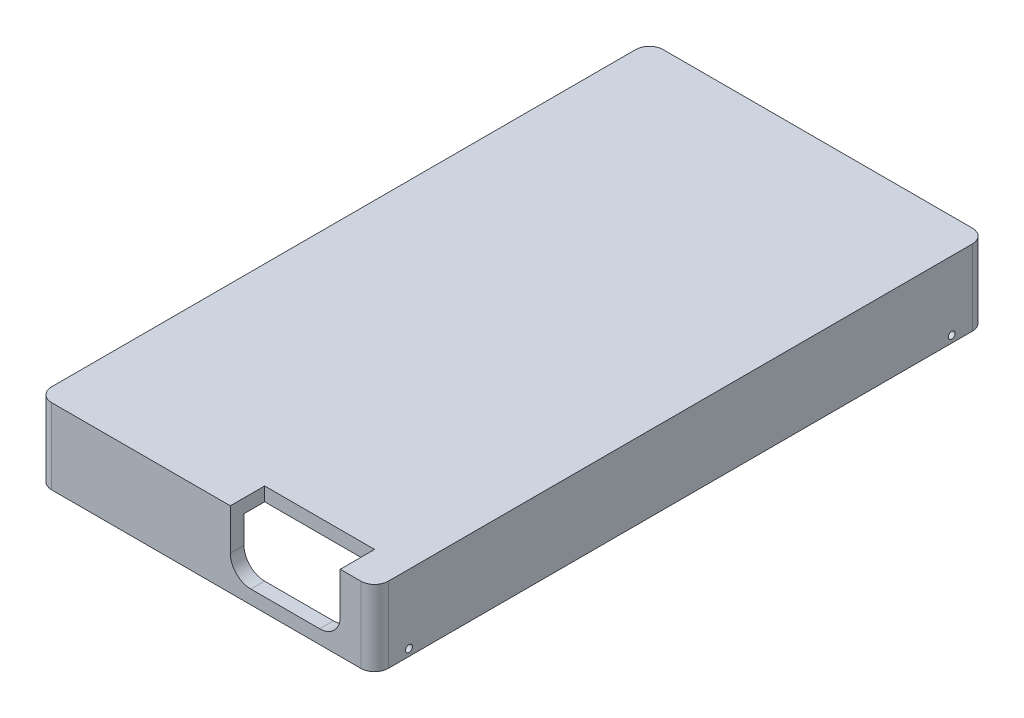
from build123d import *

# Parameters (mm, degrees)
SKETCH1_W           = 57.15
SKETCH1_H           = 107.95
BOSS_EXTRUDE1_DEPTH = 2.54
SKETCH2_W           = 62.23
SKETCH2_H           = 113.03
SKETCH2_W_2         = 57.15
SKETCH2_H_2         = 107.95
BOSS_EXTRUDE3_DEPTH = 13.97
CUT_EXTRUDE1_DEPTH  = 6.35
FILLET1_R           = 2.54
SKETCH4_R           = 0.635
CUT_EXTRUDE2_DEPTH  = 128.323438141


with BuildPart() as part:
    # Sketch1 → Boss-Extrude1 (new body)
    with BuildSketch(Plane(origin=(0, 0, 0), x_dir=(1, 0, 0), z_dir=(0, 1, 0))):
        with Locations((28.575, 53.975)):
            Rectangle(SKETCH1_W, SKETCH1_H)
    extrude(amount=BOSS_EXTRUDE1_DEPTH)

    # Sketch2 → Boss-Extrude3 (add)
    with BuildSketch(Plane(origin=(0, 2.54, 0), x_dir=(1, 0, 0), z_dir=(0, 1, 0))):
        with Locations((28.575, 53.975)):
            Rectangle(SKETCH2_W, SKETCH2_H)
        with Locations((28.575, 53.975)):
            Rectangle(SKETCH2_W_2, SKETCH2_H_2, mode=Mode.SUBTRACT)
    extrude(amount=-BOSS_EXTRUDE3_DEPTH)

    # Sketch3 → Cut-Extrude1 (cut)
    with BuildSketch(Plane.XY.offset(2.54)):
        with BuildLine():
            Line((36.83, -8.89), (49.53, -8.89))
            ThreePointArc((49.53, -8.89), (52.224076836, -7.774076836), (53.34, -5.08))
            Line((53.34, -5.08), (53.34, 2.54))
            Line((53.34, 2.54), (33.02, 2.54))
            Line((33.02, 2.54), (33.02, -5.08))
            ThreePointArc((33.02, -5.08), (34.135923164, -7.774076836), (36.83, -8.89))
        make_face()
    extrude(amount=-CUT_EXTRUDE1_DEPTH, mode=Mode.SUBTRACT)

    # Fillet1
    fillet1_edges = [part.edges().sort_by_distance(p)[0] for p in [
        (-2.54, -4.445, -110.49),
        (59.69, -4.445, -110.49),
        (59.69, -4.445, 2.54),
        (-2.54, -4.445, 2.54),
    ]]
    fillet(fillet1_edges, radius=FILLET1_R)

    # Sketch4 → Cut-Extrude2 (cut, through all)
    with BuildSketch(Plane.ZY.offset(2.54)):
        with Locations((-104.14, -10.16)):
            Circle(SKETCH4_R)
        with Locations((-3.81, -10.16)):
            Circle(SKETCH4_R)
    extrude(amount=-CUT_EXTRUDE2_DEPTH, mode=Mode.SUBTRACT)


solid = part.part
